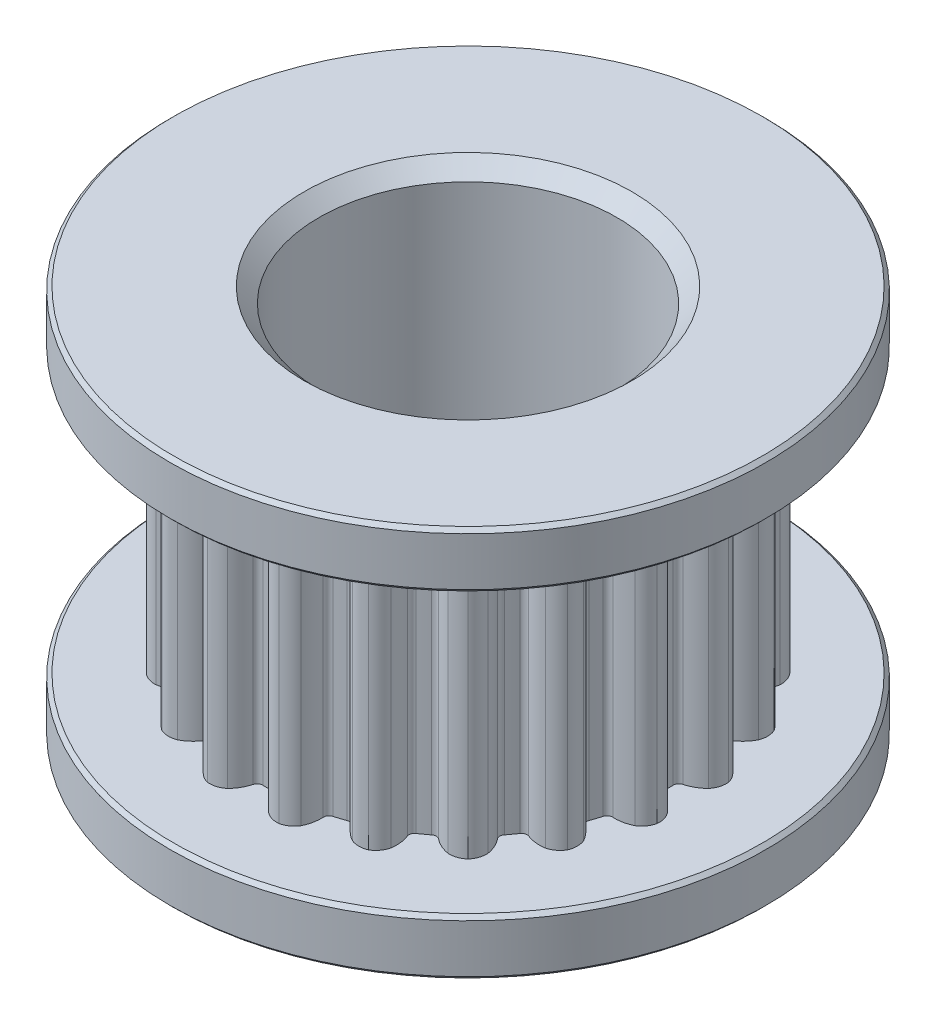
from build123d import *

# Parameters (mm, degrees)
THRUBORE_DEPTH               = 13.472469683
THRUBORE_DEPTH_BACK          = 13.472469683
THRUBORES_R                  = 4
GT2PROFILE_REACH             = 14.472
GT2PROFILE_DIRECTION_2_REACH = 14.472
GT2_GROOVE_CP_COUNT          = 20
INNERC_SIZE                  = 0.4
OUTERC_SIZE                  = 0.1


with BuildPart() as part:
    # BodyS → Body (revolve)
    with BuildSketch(Plane.XY):
        Polygon((6.11, -3.75), (6.11, 3.75), (8, 3.75), (8, 5.25), (4, 5.25), (4, 2.25), (3.5, 2.25), (3.5, -2.25), (4, -2.25), (4, -5.25), (8, -5.25), (8, -3.75), align=None)
    revolve(axis=Axis((0, 5.25, 0), (0, -1, 0)))

    # ThruBoreS → ThruBore (cut, two sides: drawn at the far end of the back side and taken through both)
    with BuildSketch(Plane(origin=(0, 0, 0), x_dir=(1, 0, 0), z_dir=(0, 1, 0)).offset(-THRUBORE_DEPTH_BACK)):
        Circle(THRUBORES_R)
    extrude(amount=THRUBORE_DEPTH + THRUBORE_DEPTH_BACK, mode=Mode.SUBTRACT)

    # GT2Profile: up to this face of the body (flat: up to its plane)
    gt2profile_end = Plane(part.part.faces().sort_by_distance((-7.77372583, -3.75, 0))[0])
    # GT2ProfileS → GT2Profile (cut, up to the picked face)
    with BuildSketch(Plane(origin=(0, 0, 0), x_dir=(1, 0, 0), z_dir=(0, 1, 0)), mode=Mode.PRIVATE) as gt2profile_sk1:
        with BuildLine():
            ThreePointArc((0.299749921, -5.468781955), (0.244461347, -5.387479579), (0.150701934, -5.357881011))
            ThreePointArc((0.150701934, -5.357881011), (0, -5.36), (-0.150701934, -5.357881011))
            ThreePointArc((-0.150701934, -5.357881011), (-0.244461347, -5.387479579), (-0.299749921, -5.468781955))
            ThreePointArc((-0.299749921, -5.468781955), (-0.396626607, -5.703924717), (-0.549685833, -5.907025885))
            ThreePointArc((-0.549685833, -5.907025885), (-0.7593874, -6.016293358), (-0.995541542, -6.028349446))
            ThreePointArc((-0.995541542, -6.028349446), (0, -6.11), (0.995541542, -6.028349446))
            ThreePointArc((0.995541542, -6.028349446), (0.7593874, -6.016293358), (0.549685833, -5.907025885))
            ThreePointArc((0.549685833, -5.907025885), (0.396626607, -5.703924717), (0.299749921, -5.468781955))
        make_face()
    gt2profile_tool1 = split(extrude(gt2profile_sk1.sketch, amount=-GT2PROFILE_REACH, mode=Mode.PRIVATE), bisect_by=gt2profile_end, keep=Keep.BOTH, mode=Mode.PRIVATE)
    gt2profile = gt2profile_tool1.solids().sort_by(Axis((0, 0, 5.802237), (0, -1, 0)))[0]
    add(gt2profile, mode=Mode.SUBTRACT)

    # GT2Profile direction 2: up to this face of the body (flat: up to its plane)
    gt2profile_direction_2_end = Plane(part.part.faces().sort_by_distance((-6.33627417, 3.75, 0))[0])
    # GT2ProfileS → GT2Profile direction 2 (cut, up to the picked face)
    with BuildSketch(Plane(origin=(0, 0, 0), x_dir=(1, 0, 0), z_dir=(0, 1, 0)), mode=Mode.PRIVATE) as gt2profile_direction_2_sk1:
        with BuildLine():
            ThreePointArc((0.299749921, -5.468781955), (0.244461347, -5.387479579), (0.150701934, -5.357881011))
            ThreePointArc((0.150701934, -5.357881011), (0, -5.36), (-0.150701934, -5.357881011))
            ThreePointArc((-0.150701934, -5.357881011), (-0.244461347, -5.387479579), (-0.299749921, -5.468781955))
            ThreePointArc((-0.299749921, -5.468781955), (-0.396626607, -5.703924717), (-0.549685833, -5.907025885))
            ThreePointArc((-0.549685833, -5.907025885), (-0.7593874, -6.016293358), (-0.995541542, -6.028349446))
            ThreePointArc((-0.995541542, -6.028349446), (0, -6.11), (0.995541542, -6.028349446))
            ThreePointArc((0.995541542, -6.028349446), (0.7593874, -6.016293358), (0.549685833, -5.907025885))
            ThreePointArc((0.549685833, -5.907025885), (0.396626607, -5.703924717), (0.299749921, -5.468781955))
        make_face()
    gt2profile_direction_2_tool1 = split(extrude(gt2profile_direction_2_sk1.sketch, amount=GT2PROFILE_DIRECTION_2_REACH, mode=Mode.PRIVATE), bisect_by=gt2profile_direction_2_end, keep=Keep.BOTH, mode=Mode.PRIVATE)
    gt2profile_direction_2 = gt2profile_direction_2_tool1.solids().sort_by(Axis((0, 0, 5.802237), (0, 1, 0)))[0]
    add(gt2profile_direction_2, mode=Mode.SUBTRACT)

    # GT2 Groove CP: GT2Profile, GT2Profile direction 2 ×20 about axis
    gt2_groove_cp_axis = Axis((0, 5.25, 0), (0, 1, 0))
    add([gt2profile.rotate(gt2_groove_cp_axis, i * 360 / GT2_GROOVE_CP_COUNT) for i in range(1, GT2_GROOVE_CP_COUNT)], mode=Mode.SUBTRACT)
    add([gt2profile_direction_2.rotate(gt2_groove_cp_axis, i * 360 / GT2_GROOVE_CP_COUNT) for i in range(1, GT2_GROOVE_CP_COUNT)], mode=Mode.SUBTRACT)

    # InnerC
    innerc_edges = [part.edges().sort_by_distance(p)[0] for p in [
        (-4, -5.25, 0),
        (-4, 5.25, 0),
    ]]
    chamfer(innerc_edges, length=INNERC_SIZE)

    # OuterC
    outerc_edges = [part.edges().sort_by_distance(p)[0] for p in [
        (-8, -5.25, 0),
        (-8, -3.75, 0),
        (-8, 3.75, 0),
        (-8, 5.25, 0),
    ]]
    chamfer(outerc_edges, length=OUTERC_SIZE)


solid = part.part
